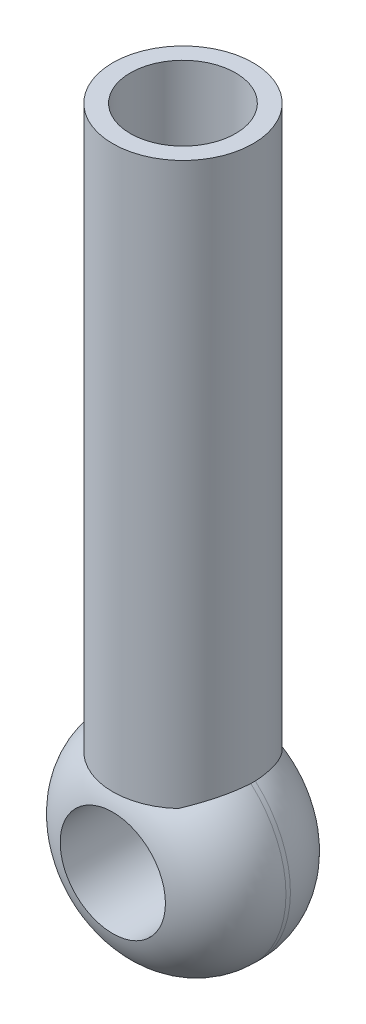
from build123d import *

# Parameters (mm, degrees)
SKETCH1_R           = 15
SKETCH1_R_2         = 7.5
BOSS_EXTRUDE1_DEPTH = 20
FILLET1_R           = 10
BOSS_EXTRUDE3_START = 10
SKETCH2_R           = 10
BOSS_EXTRUDE3_DEPTH = 80
SKETCH5_R           = 7.5
CUT_EXTRUDE3_DEPTH  = 30


with BuildPart() as part:
    # Sketch1 → Boss-Extrude1 (new body)
    with BuildSketch(Plane.XY):
        Circle(SKETCH1_R)
        Circle(SKETCH1_R_2, mode=Mode.SUBTRACT)
    extrude(amount=BOSS_EXTRUDE1_DEPTH)

    # Fillet1
    # the kernel refuses this fillet: 10 mm, written as the material it takes off along each edge
    with BuildSketch(Plane(origin=(0, 0, 0), x_dir=(1, 0, 0), z_dir=(0, -1, 0))) as fillet1_piece_1:
        with BuildLine():
            CenterArc((5, 9.682458366), FILLET1_R, 284.477512186, 75.522487814)
            Line((7.5, 0), (7.55, -0.193649167))
            ThreePointArc((7.55, -0.193649167), (11.25, -0.2), (15, -0.2))
            Line((15, -0.2), (15.2, 0))
            Line((15.2, 0), (15.2, 9.682458366))
            Line((15.2, 9.682458366), (15, 9.682458366))
        make_face()
    revolve(axis=Axis((0, 0, 0), (0, 0, 1)), mode=Mode.SUBTRACT)
    with BuildSketch(Plane(origin=(0, 0, 20), x_dir=(1, 0, 0), z_dir=(0, -1, 0))) as fillet1_piece_2:
        with BuildLine():
            CenterArc((5, -9.682458366), FILLET1_R, 0, 75.522487814)
            Line((7.5, 0), (7.55, 0.193649167))
            ThreePointArc((7.55, 0.193649167), (11.25, 0.2), (15, 0.2))
            Line((15, 0.2), (15.2, 0))
            Line((15.2, 0), (15.2, -9.682458366))
            Line((15.2, -9.682458366), (15, -9.682458366))
        make_face()
    revolve(axis=Axis((0, 0, 20), (0, 0, 1)), mode=Mode.SUBTRACT)

    # Sketch2 → Boss-Extrude3 (add)
    with BuildSketch(Plane(origin=(0, 0, 0), x_dir=(1, 0, 0), z_dir=(0, 1, 0)).offset(BOSS_EXTRUDE3_START)):
        with Locations(Location((0, -10, 0), (0, 0, 47.908263914))):
            Circle(SKETCH2_R)
    extrude(amount=BOSS_EXTRUDE3_DEPTH)

    # Sketch5 → Cut-Extrude3 (cut)
    with BuildSketch(Plane(origin=(0, 90, 0), x_dir=(1, 0, 0), z_dir=(0, 1, 0))):
        with Locations(Location((0, -10, 0), (0, 0, 270))):
            Circle(SKETCH5_R)
    extrude(amount=-CUT_EXTRUDE3_DEPTH, mode=Mode.SUBTRACT)


solid = part.part
